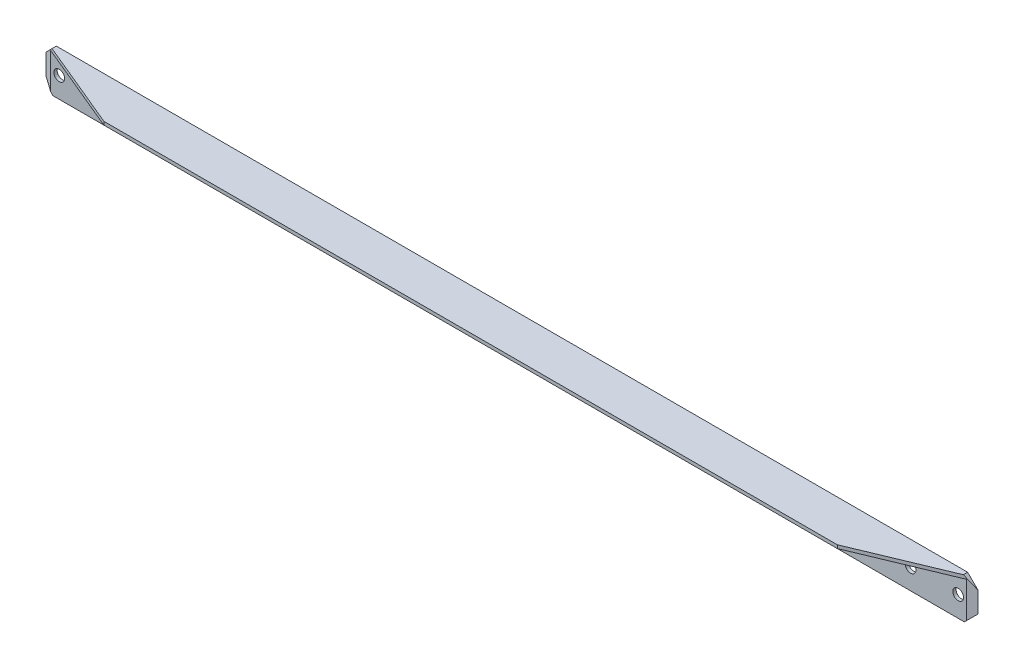
from build123d import *

# Parameters (mm, degrees)
SKETCH_1_W          = 2252
SKETCH_1_H          = 100
SKETCH_1_R          = 13
EXTRUDE_1_DEPTH     = 8
SKETCH_2_W          = 2252
SKETCH_2_H          = 8
EXTRUDE_2_DEPTH     = 92
CHAMFER_3_SIZE      = 25
CHAMFER_4_SIZE      = 25
CUT_EXTRUDE_3_DEPTH = 1135.846245092
CHAMFER_5_SIZE      = 25
CHAMFER_6_SIZE      = 25


with BuildPart() as part:
    # 草图1 → 凸台-拉伸1 (new body)
    with BuildSketch(Plane.XY):
        with Locations((0, 50)):
            Rectangle(SKETCH_1_W, SKETCH_1_H)
        with Locations((1086, 50)):
            Circle(SKETCH_1_R, mode=Mode.SUBTRACT)
        with Locations((971, 50)):
            Circle(SKETCH_1_R, mode=Mode.SUBTRACT)
        with Locations((0, 50)):
            Circle(SKETCH_1_R, mode=Mode.SUBTRACT)
        with Locations((80, 50)):
            Circle(SKETCH_1_R, mode=Mode.SUBTRACT)
        with Locations((160, 50)):
            Circle(SKETCH_1_R, mode=Mode.SUBTRACT)
        with Locations((-80, 50)):
            Circle(SKETCH_1_R, mode=Mode.SUBTRACT)
        with Locations((-160, 50)):
            Circle(SKETCH_1_R, mode=Mode.SUBTRACT)
        with Locations((-971, 50)):
            Circle(SKETCH_1_R, mode=Mode.SUBTRACT)
        with Locations((-1086, 50)):
            Circle(SKETCH_1_R, mode=Mode.SUBTRACT)
    extrude(amount=EXTRUDE_1_DEPTH)

    # 草图2 → 凸台-拉伸2 (add)
    with BuildSketch(Plane.XY.offset(8)):
        with Locations((0, 96)):
            Rectangle(SKETCH_2_W, SKETCH_2_H)
    extrude(amount=EXTRUDE_2_DEPTH)

    # 倒角3
    chamfer_3_edges = [part.edges().sort_by_distance(p)[0] for p in [
        (1126, 0, 4),
    ]]
    chamfer(chamfer_3_edges, length=CHAMFER_3_SIZE)

    # 倒角4
    chamfer_4_edges = [part.edges().sort_by_distance(p)[0] for p in [
        (1126, 100, 50),
    ]]
    chamfer(chamfer_4_edges, length=CHAMFER_4_SIZE)

    # 草图3 → 切除-拉伸3 (cut, through all)
    with BuildSketch(Plane(origin=(0, 100, 0), x_dir=(1, 0, 0), z_dir=(0, 1, 0))):
        Polygon((886, -100), (1126, 0), (1126, -100), align=None)
    cut_extrude_3 = extrude(amount=-CUT_EXTRUDE_3_DEPTH, mode=Mode.SUBTRACT)

    # 倒角5
    chamfer_5_edges = [part.edges().sort_by_distance(p)[0] for p in [
        (-1126, 0, 4),
    ]]
    chamfer(chamfer_5_edges, length=CHAMFER_5_SIZE)

    # 倒角6
    chamfer_6_edges = [part.edges().sort_by_distance(p)[0] for p in [
        (-1126, 100, 50),
    ]]
    chamfer(chamfer_6_edges, length=CHAMFER_6_SIZE)

    # 镜向8: 切除-拉伸3 across plane
    add(cut_extrude_3.mirror(Plane(origin=(0, 0, 0), x_dir=(0, 0, 1), z_dir=(1, 0, 0))), mode=Mode.SUBTRACT)


solid = part.part
